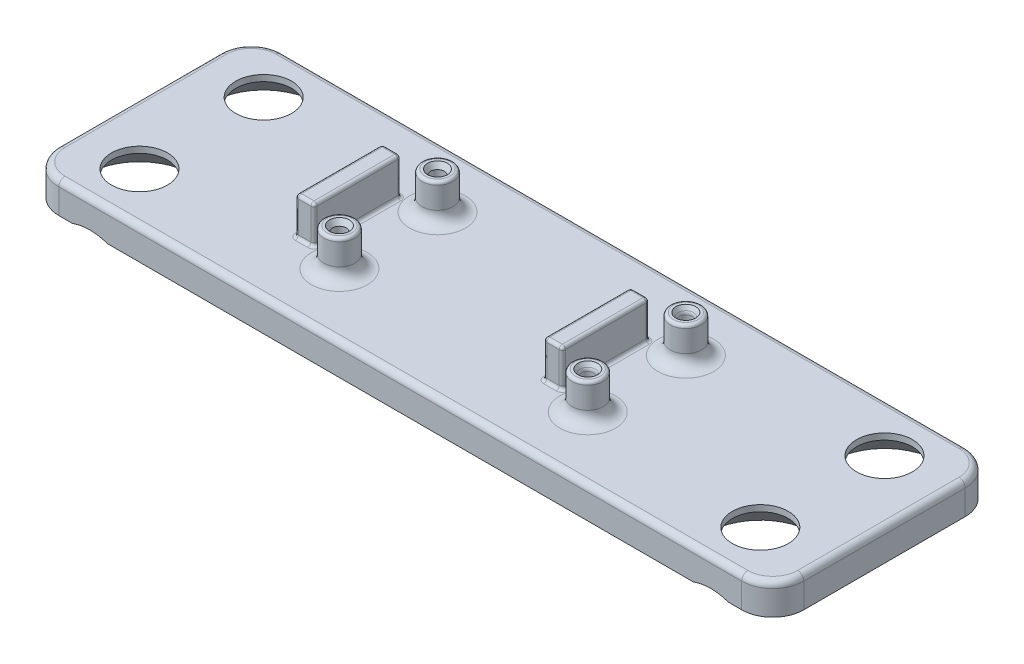
from build123d import *
from OCP.BRepFilletAPI import BRepFilletAPI_MakeChamfer

# Parameters (mm, degrees)
SKETCH_1_W          = 120
SKETCH_1_H          = 36
SKETCH_1_R          = 4.5
EXTRUDE_1_DEPTH     = 5
FILLET_1_R          = 5
SKETCH_2_R          = 2.5
SKETCH_2_R_2        = 1.1
SKETCH_2_W          = 3
SKETCH_2_H          = 14
EXTRUDE_2_DEPTH     = 6
CUT_EXTRUDE_START   = -8
SKETCH_3_R          = 1.1
CUT_EXTRUDE_1_DEPTH = 8
FILLET_2_R          = 2
FILLET_3_R          = 0.5
FILLET_4_R          = 1
CHAMFER_1_SIZE      = 4
CHAMFER_3_SIZE      = 0.5
CHAMFER_3_SIZE2     = 0.866025404
FILLET_5_R          = 1


with BuildPart() as part:
    # Эскиз1 → Бобышка-Вытянуть1 (new body)
    with BuildSketch(Plane(origin=(0, 0, 0), x_dir=(1, 0, 0), z_dir=(0, 1, 0))):
        Rectangle(SKETCH_1_W, SKETCH_1_H)
        with Locations(Location((-50, -10, 0), (0, 0, 270))):
            Circle(SKETCH_1_R, mode=Mode.SUBTRACT)
        with Locations(Location((50, -10, 0), (0, 0, 90))):
            Circle(SKETCH_1_R, mode=Mode.SUBTRACT)
        with Locations(Location((50, 10, 0), (0, 0, 90))):
            Circle(SKETCH_1_R, mode=Mode.SUBTRACT)
        with Locations(Location((-50, 10, 0), (0, 0, 270))):
            Circle(SKETCH_1_R, mode=Mode.SUBTRACT)
    extrude(amount=EXTRUDE_1_DEPTH)

    # Скругление1
    fillet_1_edges = [part.edges().sort_by_distance(p)[0] for p in [
        (60, 2.5, 18),
        (-60, 2.5, 18),
        (-60, 2.5, -18),
        (60, 2.5, -18),
    ]]
    fillet(fillet_1_edges, radius=FILLET_1_R)

    # Эскиз2 → Бобышка-Вытянуть2 (add)
    # profile 1 of 6: a face of its own
    with BuildSketch(Plane(origin=(0, 5, 0), x_dir=(1, 0, 0), z_dir=(0, 1, 0))):
        with Locations(Location((20, 8, 0), (0, 0, 90))):
            Circle(SKETCH_2_R)
        with Locations(Location((20, 8, 0), (0, 0, 90))):
            Circle(SKETCH_2_R_2, mode=Mode.SUBTRACT)
    # profile 2 of 6: a face of its own
    with BuildSketch(Plane(origin=(0, 5, 0), x_dir=(1, 0, 0), z_dir=(0, 1, 0))):
        with Locations(Location((20, -7.8, 0), (0, 0, 90))):
            Circle(SKETCH_2_R)
        with Locations(Location((20, -7.8, 0), (0, 0, 270))):
            Circle(SKETCH_2_R_2, mode=Mode.SUBTRACT)
    # profile 3 of 6: a face of its own
    with BuildSketch(Plane(origin=(0, 5, 0), x_dir=(1, 0, 0), z_dir=(0, 1, 0))):
        with Locations(Location((-20, 8, 0), (0, 0, 90))):
            Circle(SKETCH_2_R)
        with Locations(Location((-20, 8, 0), (0, 0, 90))):
            Circle(SKETCH_2_R_2, mode=Mode.SUBTRACT)
    # profile 4 of 6: a face of its own
    with BuildSketch(Plane(origin=(0, 5, 0), x_dir=(1, 0, 0), z_dir=(0, 1, 0))):
        with Locations(Location((-20, -7.8, 0), (0, 0, 90))):
            Circle(SKETCH_2_R)
        with Locations(Location((-20, -7.8, 0), (0, 0, 270))):
            Circle(SKETCH_2_R_2, mode=Mode.SUBTRACT)
    # profile 5 of 6: a face of its own
    with BuildSketch(Plane(origin=(0, 5, 0), x_dir=(1, 0, 0), z_dir=(0, 1, 0))):
        with Locations((13.5, 0.1)):
            Rectangle(SKETCH_2_W, SKETCH_2_H)
    # profile 6 of 6: a face of its own
    with BuildSketch(Plane(origin=(0, 5, 0), x_dir=(1, 0, 0), z_dir=(0, 1, 0))):
        with Locations((-26.5, 0.1)):
            Rectangle(SKETCH_2_W, SKETCH_2_H)
    extrude(amount=EXTRUDE_2_DEPTH)

    # Эскиз3 → Cut-Extrude 1 (cut)
    with BuildSketch(Plane(origin=(0, 11, 0), x_dir=(1, 0, 0), z_dir=(0, 1, 0)).offset(CUT_EXTRUDE_START)):
        with Locations(Location((20, -7.8, 0), (0, 0, 270))):
            Circle(SKETCH_3_R)
        with Locations(Location((20, 8, 0), (0, 0, 90))):
            Circle(SKETCH_3_R)
    extrude(amount=CUT_EXTRUDE_1_DEPTH, mode=Mode.SUBTRACT)

    # Скругление2
    fillet_2_edges = [part.edges().sort_by_distance(p)[0] for p in [
        (20, 5, -5.5),
        (20, 5, 10.3),
        (-20, 5, -5.5),
        (-20, 5, 10.3),
    ]]
    fillet(fillet_2_edges, radius=FILLET_2_R)

    # Скругление3
    fillet_3_edges = [part.edges().sort_by_distance(p)[0] for p in [
        (20, 11, -5.5),
        (20, 11, 10.3),
        (13.5, 5, -7.1),
        (15, 8, -7.1),
        (12, 5, -0.1),
        (12, 8, -7.1),
        (13.5, 5, 6.9),
        (12, 8, 6.9),
        (15, 5, -0.1),
        (15, 8, 6.9),
        (13.5, 11, -7.1),
        (12, 11, -0.1),
        (13.5, 11, 6.9),
        (15, 11, -0.1),
        (-20, 11, -5.5),
        (-20, 11, 10.3),
        (-26.5, 5, -7.1),
        (-25, 8, -7.1),
        (-28, 5, -0.1),
        (-28, 8, -7.1),
        (-26.5, 5, 6.9),
        (-28, 8, 6.9),
        (-25, 5, -0.1),
        (-25, 8, 6.9),
        (-26.5, 11, -7.1),
        (-28, 11, -0.1),
        (-26.5, 11, 6.9),
        (-25, 11, -0.1),
    ]]
    fillet(fillet_3_edges, radius=FILLET_3_R)

    # Скругление4
    fillet_4_edges = [part.edges().sort_by_distance(p)[0] for p in [
        (-60, 5, 0),
        (0, 5, -18),
        (60, 5, 0),
        (0, 5, 18),
        (58.535533906, 5, 16.535533906),
        (58.535533906, 5, -16.535533906),
        (-58.535533906, 5, 16.535533906),
        (-58.535533906, 5, -16.535533906),
    ]]
    fillet(fillet_4_edges, radius=FILLET_4_R)

    # Фаска1
    # the kernel refuses this chamfer: 4 mm, written as the material it takes off along each edge
    with BuildSketch(Plane(origin=(-50, 0, 10), x_dir=(0, 0, 1), z_dir=(-1, 0, 0))) as chamfer_1_piece_1:
        Polygon((4.5, CHAMFER_1_SIZE), (4.5 + CHAMFER_1_SIZE, 0), (4.5, 0), align=None)
    revolve(axis=Axis((-50, 0, 10), (0, 1, 0)), mode=Mode.SUBTRACT)
    with BuildSketch(Plane(origin=(50, 0, 10), x_dir=(0, 0, -1), z_dir=(1, 0, 0))) as chamfer_1_piece_2:
        Polygon((4.5, CHAMFER_1_SIZE), (4.5 + CHAMFER_1_SIZE, 0), (4.5, 0), align=None)
    revolve(axis=Axis((50, 0, 10), (0, 1, 0)), mode=Mode.SUBTRACT)
    with BuildSketch(Plane(origin=(50, 0, -10), x_dir=(0, 0, -1), z_dir=(1, 0, 0))) as chamfer_1_piece_3:
        Polygon((4.5, CHAMFER_1_SIZE), (4.5 + CHAMFER_1_SIZE, 0), (4.5, 0), align=None)
    revolve(axis=Axis((50, 0, -10), (0, 1, 0)), mode=Mode.SUBTRACT)
    with BuildSketch(Plane(origin=(-50, 0, -10), x_dir=(0, 0, 1), z_dir=(-1, 0, 0))) as chamfer_1_piece_4:
        Polygon((4.5, CHAMFER_1_SIZE), (4.5 + CHAMFER_1_SIZE, 0), (4.5, 0), align=None)
    revolve(axis=Axis((-50, 0, -10), (0, 1, 0)), mode=Mode.SUBTRACT)

    # Фаска3: one chamfer whose edges measure the first distance from different faces: ONE call of the kernel's chamfer builder (chamfer() names one face for all edges)
    chamfer_3_edges_1 = [part.edges().sort_by_distance(p)[0] for p in [
        (20, 11, -6.9),
    ]]
    chamfer_3_side_1 = [part.faces().sort_by_distance(p)[0] for p in [
        (20, 11, -6.056568542),
    ]]
    chamfer_3_edges_2 = [part.edges().sort_by_distance(p)[0] for p in [
        (20, 11, 6.7),
    ]]
    chamfer_3_side_2 = [part.faces().sort_by_distance(p)[0] for p in [
        (20, 11, 9.743431458),
    ]]
    chamfer_3_edges_3 = [part.edges().sort_by_distance(p)[0] for p in [
        (-20, 11, -6.9),
    ]]
    chamfer_3_side_3 = [part.faces().sort_by_distance(p)[0] for p in [
        (-20, 11, -6.056568542),
    ]]
    chamfer_3_edges_4 = [part.edges().sort_by_distance(p)[0] for p in [
        (-20, 11, 6.7),
    ]]
    chamfer_3_side_4 = [part.faces().sort_by_distance(p)[0] for p in [
        (-20, 11, 9.743431458),
    ]]
    chamfer_3 = BRepFilletAPI_MakeChamfer(part.part.solid().wrapped)
    for e in chamfer_3_edges_1:
        chamfer_3.Add(CHAMFER_3_SIZE, CHAMFER_3_SIZE2, e.wrapped, chamfer_3_side_1[0].wrapped)  # the first distance lies on this face
    for e in chamfer_3_edges_2:
        chamfer_3.Add(CHAMFER_3_SIZE, CHAMFER_3_SIZE2, e.wrapped, chamfer_3_side_2[0].wrapped)  # the first distance lies on this face
    for e in chamfer_3_edges_3:
        chamfer_3.Add(CHAMFER_3_SIZE, CHAMFER_3_SIZE2, e.wrapped, chamfer_3_side_3[0].wrapped)  # the first distance lies on this face
    for e in chamfer_3_edges_4:
        chamfer_3.Add(CHAMFER_3_SIZE, CHAMFER_3_SIZE2, e.wrapped, chamfer_3_side_4[0].wrapped)  # the first distance lies on this face
    add(Compound.cast(chamfer_3.Shape()), mode=Mode.REPLACE)

    # Скругление5
    fillet_5_edges = [part.edges().sort_by_distance(p)[0] for p in [
        (20, 10.133974596, 6.7),
        (20, 10.133974596, -6.9),
    ]]
    fillet(fillet_5_edges, radius=FILLET_5_R)


solid = part.part
